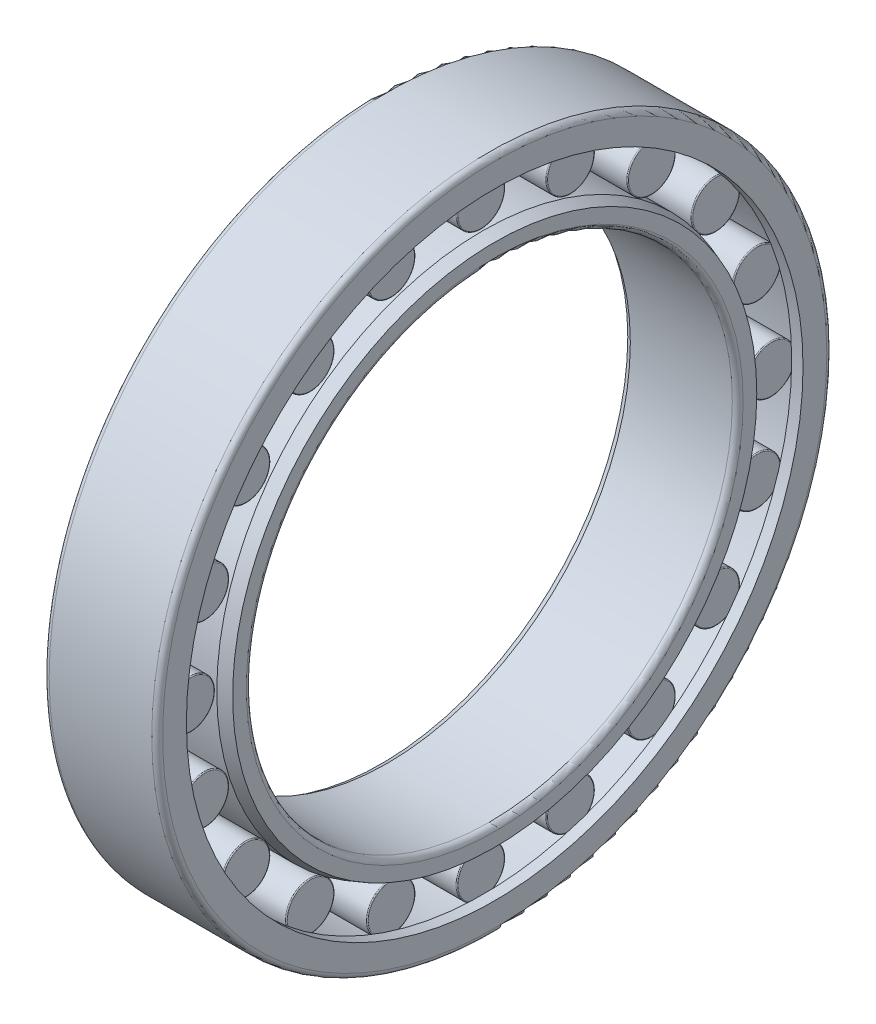
from build123d import *

# Parameters (mm, degrees)
ROLLERSDETAILED_COUNT = 20
ROLLERSDETAILED_ANGLE = 342


with BuildPart() as part:
    # OutRacSke → OuterRace (revolve)
    with BuildSketch(Plane.XY):
        with BuildLine():
            Line((-16.8, 114.18875), (-21, 114.18875))
            Line((-21, 114.18875), (-21, 123))
            ThreePointArc((-21, 123), (-20.414213562, 124.414213562), (-19, 125))
            Line((-19, 125), (19, 125))
            ThreePointArc((19, 125), (20.414213562, 124.414213562), (21, 123))
            Line((21, 123), (21, 114.18875))
            Line((21, 114.18875), (16.8, 114.18875))
            Line((16.8, 114.18875), (16.8, 116.42))
            Line((16.8, 116.42), (-16.8, 116.42))
            Line((-16.8, 116.42), (-16.8, 114.18875))
        make_face()
    revolve(axis=Axis((-90, 0, 0), (1, 0, 0)))

    # RolDetSke → RollerDetailed (revolve)
    with BuildSketch(Plane.XY):
        with BuildLine():
            Line((-15.96, 116.068), (-15.96, 107.5))
            Line((-15.96, 107.5), (15.96, 107.5))
            Line((15.96, 107.5), (15.96, 116.068))
            ThreePointArc((15.96, 116.068), (15.855437121, 116.320437121), (15.603, 116.425))
            Line((15.603, 116.425), (-15.603, 116.425))
            ThreePointArc((-15.603, 116.425), (-15.855437121, 116.320437121), (-15.96, 116.068))
        make_face()
    rollerdetailed = revolve(axis=Axis((-33.6, 107.5, 0), (1, 0, 0)))

    # InsRacSke → InnerRace (revolve)
    with BuildSketch(Plane.XY):
        with BuildLine():
            Line((-16.958911274, 98.58), (-21, 96.34875))
            Line((-21, 96.34875), (-21, 91.288212788))
            Line((-21, 91.288212788), (-18.76875, 90))
            Line((-18.76875, 90), (19, 90))
            ThreePointArc((19, 90), (20.414213562, 90.585786438), (21, 92))
            Line((21, 92), (21, 97.060537212))
            Line((21, 97.060537212), (16.641088726, 98.58))
            Line((16.641088726, 98.58), (-16.958911274, 98.58))
        make_face()
    revolve(axis=Axis((-90, 0, 0), (1, 0, 0)))

    # RollersDetailed: RollerDetailed ×20 about axis
    rollersdetailed_axis = Axis((-50, 0, 0), (1, 0, 0))
    for i in range(1, ROLLERSDETAILED_COUNT):
        add(rollerdetailed.rotate(rollersdetailed_axis, i * ROLLERSDETAILED_ANGLE / (ROLLERSDETAILED_COUNT - 1)))


solid = part.part
